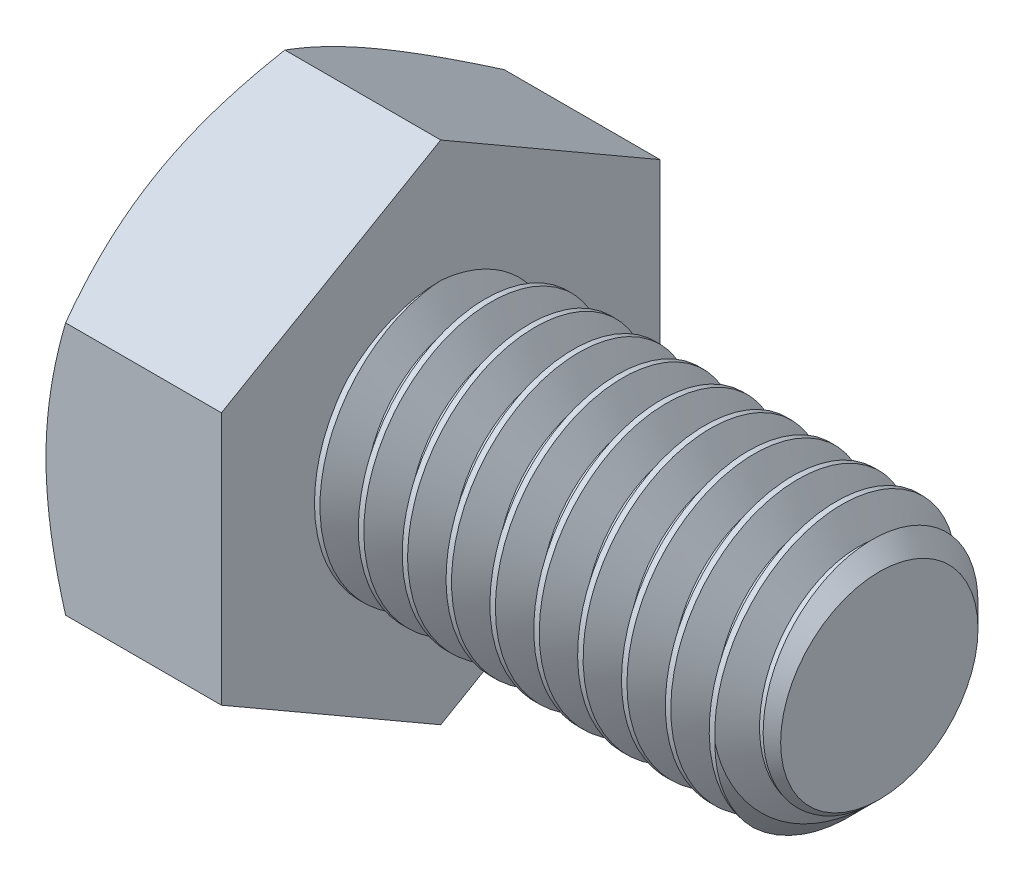
from build123d import *

# Parameters (mm, degrees)
SKETCH2_R           = 3
BOSS_EXTRUDE1_DEPTH = 10
CHAMFER1_SIZE       = 0.75
CUT_SWEEP1_PITCH    = 1
BOSS_EXTRUDE2_DEPTH = 4
SKETCH6_OUTSIDE_W   = 74.854
SKETCH6_OUTSIDE_H   = 76.402
SKETCH6_OUTSIDE_R   = 5
CUT_EXTRUDE1_DEPTH  = 16.947831774
CUT_EXTRUDE1_DRAFT  = -60
SKETCH7_W           = 0.197562976
SKETCH7_H           = 0.197562976
CUT_EXTRUDE2_DEPTH  = 0.25


with BuildPart() as part:
    # Sketch2 → Boss-Extrude1 (new body)
    with BuildSketch(Plane(origin=(7, 0, 0), x_dir=(0, 0, -1), z_dir=(1, 0, 0))):
        Circle(SKETCH2_R)
    extrude(amount=-BOSS_EXTRUDE1_DEPTH)

    # Chamfer1
    chamfer1_edges = [part.edges().sort_by_distance(p)[0] for p in [
        (7, 0, 3),
    ]]
    chamfer(chamfer1_edges, length=CHAMFER1_SIZE)

    # Cut-Sweep1: the profile of Sketch5 profile screwed along a right-hand helix of 11 turns, 8 arcs to a turn; built about Z, then put on its axis
    cut_sweep1_z = Axis((0, 0, 0), (0, 0, 1))
    cut_sweep1_corners = [(3.0003, 0, 0.000173205), (2.350480947, 0, -0.375), (2.350480947, 0, -0.5), (3.0003, 0, -0.875173205)]
    with BuildLine(mode=Mode.PRIVATE) as cut_sweep1_profile:
        Line(cut_sweep1_corners[0], cut_sweep1_corners[1])
        Line(cut_sweep1_corners[1], cut_sweep1_corners[2])
        Line(cut_sweep1_corners[2], cut_sweep1_corners[3])
        Line(cut_sweep1_corners[3], cut_sweep1_corners[0])
    cut_sweep1_cap = Face(cut_sweep1_profile.wire())
    cut_sweep1_turn_angles = [0, 22.5, 45, 67.5, 90, 112.5, 135, 157.5, 180, 202.5, 225, 247.5, 270, 292.5, 315, 337.5, 360]
    cut_sweep1_turn_weights = [1, 0.9238795325112867, 1, 0.9238795325112867, 1, 0.9238795325112867, 1, 0.9238795325112867, 1, 0.9238795325112867, 1, 0.9238795325112867, 1, 0.9238795325112867, 1, 0.9238795325112867, 1]
    cut_sweep1_turn_rails = [Edge.make_bspline([Vector(p[0], p[1], 0).rotate(cut_sweep1_z, cut_sweep1_turn_angles[k]) / cut_sweep1_turn_weights[k] + Vector(0, 0, p[2] + CUT_SWEEP1_PITCH * cut_sweep1_turn_angles[k] / 360) for k in range(17)], [0, 0, 0, 1, 1, 2, 2, 3, 3, 4, 4, 5, 5, 6, 6, 7, 7, 8, 8, 8], 2, cut_sweep1_turn_weights) for p in cut_sweep1_corners]
    cut_sweep1_turn_sides = [Face.make_surface_from_curves(cut_sweep1_turn_rails[p[0]], cut_sweep1_turn_rails[p[1]]) for p in [(0, 1), (1, 2), (2, 3), (3, 0)]]
    cut_sweep1 = Plane(origin=(7, 0, 0), x_dir=(0, 1, 0), z_dir=(-1, 0, 0)) * Solid(Shell([*[p.moved(Location((0, 0, CUT_SWEEP1_PITCH * i))) for i in range(11) for p in cut_sweep1_turn_sides], cut_sweep1_cap, cut_sweep1_cap.rotate(cut_sweep1_z, 3960).moved(Location((0, 0, CUT_SWEEP1_PITCH * 3960 / 360)))]))
    add(cut_sweep1, mode=Mode.SUBTRACT)

    # Sketch3 → Boss-Extrude2 (add)
    with BuildSketch(Plane.ZY.offset(3)):
        Polygon((-5, -2.886751346), (0, -5.773502692), (5, -2.886751346), (5, 2.886751346), (0, 5.773502692), (-5, 2.886751346), align=None)
    extrude(amount=BOSS_EXTRUDE2_DEPTH)


with BuildPart() as cut_extrude1_tool:
    # Sketch6 outside → Cut-Extrude1 (with draft: the straight prism first)
    with BuildSketch(Plane.ZY.offset(7)):
        Rectangle(SKETCH6_OUTSIDE_W, SKETCH6_OUTSIDE_H)
        Circle(SKETCH6_OUTSIDE_R, mode=Mode.SUBTRACT)
    extrude(amount=-CUT_EXTRUDE1_DEPTH)
    # Cut-Extrude1: the draft: its side faces are tilted about the plane it starts from
    cut_extrude1_sides = [cut_extrude1_tool.faces().sort_by_distance(p)[0] for p in [
        (1.473915887, -38.201, 0),
        (1.473915887, 0, 37.427),
        (1.473915887, 38.201, 0),
        (1.473915887, 0, -37.427),
        (1.473915887, 0, -5),
    ]]
    draft(cut_extrude1_sides, Plane.ZY.offset(7), CUT_EXTRUDE1_DRAFT)


with BuildPart() as part_1:
    add(part.part)

    # Cut-Extrude1: cut by cut_extrude1_tool
    add(cut_extrude1_tool.part, mode=Mode.SUBTRACT)

    # Sketch7 → Cut-Extrude2 (cut)
    # profile 1 of 4: a face of its own
    with BuildSketch(Plane.ZY.offset(7)):
        with BuildLine():
            Line((-1.284159342, 2.5), (-1.481722318, 2.5))
            Line((-1.481722318, 2.5), (-1.481722318, 3.700812462))
            add(Edge.make_bspline(
                [(-1.481722318, 3.700812462), (-1.493098012, 3.689842005), (-1.516741144, 3.667041113), (-1.556707362, 3.634772156), (-1.601314769, 3.602066201), (-1.649984109, 3.570615769), (-1.699594268, 3.541008578), (-1.7475361, 3.514381463), (-1.793009194, 3.491848462), (-1.822962567, 3.479527328), (-1.837335675, 3.47361504)],
                knots=[0, 0, 0, 0, 0.893362401, 1.856755847, 2.901947673, 4.020460078, 5.132200827, 6.168787962, 7.121294059, 8, 8, 8, 8], degree=3))
            Line((-1.837335675, 3.47361504), (-1.837335675, 3.655743408))
            add(Edge.make_bspline(
                [(-1.837335675, 3.655743408), (-1.812648378, 3.668457416), (-1.763991177, 3.693515971), (-1.695249075, 3.736795542), (-1.631070927, 3.783712378), (-1.572519137, 3.834256092), (-1.520031188, 3.885920841), (-1.475798832, 3.938052602), (-1.438788011, 3.98874045), (-1.42021898, 4.024089603), (-1.411340508, 4.040991211)],
                knots=[0, 0, 0, 0, 1.141258006, 2.249351951, 3.335817539, 4.406819942, 5.426913362, 6.360259544, 7.215985427, 8, 8, 8, 8], degree=3))
            Line((-1.411340508, 4.040991211), (-1.284159342, 4.040991211))
            Line((-1.284159342, 4.040991211), (-1.284159342, 2.5))
        make_face()
    # profile 2 of 4: a face of its own
    with BuildSketch(Plane.ZY.offset(7)):
        with BuildLine():
            add(Edge.make_bspline(
                [(-0.790251903, 3.260000072), (-0.790052858, 3.282022251), (-0.789663013, 3.325154426), (-0.787244933, 3.388264546), (-0.783023159, 3.448197614), (-0.776721214, 3.50490158), (-0.769258531, 3.558504437), (-0.759556995, 3.608929689), (-0.748641356, 3.656290471), (-0.735544549, 3.700537418), (-0.721155446, 3.742050974), (-0.704830549, 3.780764541), (-0.686462825, 3.816637074), (-0.666954934, 3.85004059), (-0.645279941, 3.880455529), (-0.622746104, 3.908735457), (-0.597715799, 3.933843239), (-0.57122984, 3.956424902), (-0.542898213, 3.976351902), (-0.512870822, 3.993546501), (-0.481263204, 4.008728091), (-0.447472952, 4.020156788), (-0.412201546, 4.029473599), (-0.375177484, 4.036327159), (-0.336359967, 4.040367563), (-0.309833651, 4.04078098), (-0.296344464, 4.040991211)],
                knots=[0, 0, 0, 0, 1.514747001, 2.966751498, 4.343369068, 5.64627492, 6.890416844, 8.064737671, 9.177176366, 10.232018008, 11.237056675, 12.19799043, 13.119080079, 14.007588942, 14.855863561, 15.685992447, 16.491747269, 17.290132607, 18.077525251, 18.870243746, 19.668095604, 20.485086593, 21.319398728, 22.175900658, 23.072407314, 24, 24, 24, 24], degree=3))
            add(Edge.make_bspline(
                [(-0.296344464, 4.040991211), (-0.276554072, 4.040409387), (-0.237675053, 4.039266372), (-0.180911485, 4.029944144), (-0.127415481, 4.013997036), (-0.077221797, 3.992483699), (-0.031188485, 3.965157621), (0.009921203, 3.93193861), (0.045663832, 3.893175459), (0.075649327, 3.848408838), (0.101859643, 3.798873708), (0.125144312, 3.744347738), (0.146192977, 3.68489203), (0.161129567, 3.631670872), (0.171783825, 3.585728479), (0.178836097, 3.547836494), (0.184690897, 3.506950828), (0.189176465, 3.463170395), (0.192856768, 3.416544299), (0.195698897, 3.36704351), (0.197141568, 3.314544309), (0.197419873, 3.278522328), (0.197562976, 3.260000072)],
                knots=[0, 0, 0, 0, 1.134486744, 2.228744715, 3.287356444, 4.328707449, 5.352829806, 6.347195599, 7.349461267, 8.364207941, 9.428085653, 10.559314403, 11.761222316, 13.04268526, 13.726896727, 14.465273606, 15.252205015, 16.094778733, 16.988606776, 17.934225168, 18.937792761, 20, 20, 20, 20], degree=3))
            add(Edge.make_bspline(
                [(0.197562976, 3.260000072), (0.197360203, 3.238081335), (0.196964045, 3.195258767), (0.194610758, 3.132654684), (0.190134593, 3.073173782), (0.184626591, 3.016679807), (0.176294137, 2.963323573), (0.167315467, 2.912878383), (0.156211069, 2.865573301), (0.143254845, 2.821387596), (0.128663193, 2.78008763), (0.11266119, 2.74136128), (0.094937435, 2.705235008), (0.074964401, 2.672061172), (0.053655947, 2.641399446), (0.03085601, 2.613134809), (0.006081205, 2.587674071), (-0.020643434, 2.565160142), (-0.048776137, 2.544879764), (-0.07887653, 2.527515404), (-0.110812868, 2.513129332), (-0.144371773, 2.500829956), (-0.179893749, 2.491817695), (-0.217098671, 2.484918949), (-0.256123623, 2.480856468), (-0.282752541, 2.480450776), (-0.296344464, 2.480243702)],
                knots=[0, 0, 0, 0, 1.508974709, 2.94807912, 4.311757619, 5.615040294, 6.854280449, 8.028314546, 9.141715822, 10.197470207, 11.196696834, 12.155719058, 13.080757287, 13.963948316, 14.818758719, 15.649605906, 16.461113142, 17.260189315, 18.052359509, 18.845763934, 19.647754795, 20.461145776, 21.303032214, 22.167241874, 23.064524267, 24, 24, 24, 24], degree=3))
            add(Edge.make_bspline(
                [(-0.296344464, 2.480243702), (-0.31416505, 2.480752036), (-0.348910289, 2.481743145), (-0.399653148, 2.488477126), (-0.447278028, 2.500329248), (-0.492186617, 2.516224614), (-0.533874131, 2.537485582), (-0.572539611, 2.563353701), (-0.608960011, 2.593227122), (-0.629925808, 2.616796566), (-0.64053621, 2.628724626)],
                knots=[0, 0, 0, 0, 1.10322584, 2.150986741, 3.161425019, 4.136713905, 5.093944212, 6.049774532, 7.013026876, 8, 8, 8, 8], degree=3))
            add(Edge.make_bspline(
                [(-0.64053621, 2.628724626), (-0.652749028, 2.646341795), (-0.677932381, 2.682669151), (-0.707407312, 2.744610663), (-0.733699472, 2.81279957), (-0.754333998, 2.888573732), (-0.770495975, 2.971330072), (-0.782168957, 3.061230974), (-0.788774716, 3.158237599), (-0.789748392, 3.225313505), (-0.790251903, 3.260000072)],
                knots=[0, 0, 0, 0, 0.779365345, 1.607084704, 2.489375761, 3.438383567, 4.461919411, 5.557722155, 6.737039282, 8, 8, 8, 8], degree=3))
        make_face()
        with BuildLine():
            add(Edge.make_bspline(
                [(-0.592688927, 3.260617457), (-0.592492763, 3.230978591), (-0.592117261, 3.174243246), (-0.588194178, 3.093187016), (-0.581440751, 3.020063233), (-0.57251228, 2.954973141), (-0.560723083, 2.897828693), (-0.545920352, 2.84877551), (-0.529234153, 2.807224843), (-0.508585298, 2.77369168), (-0.485977083, 2.746357261), (-0.462635646, 2.722848776), (-0.438011843, 2.702867102), (-0.412266343, 2.686206461), (-0.384999685, 2.673592119), (-0.356510025, 2.664449215), (-0.326791165, 2.659187614), (-0.30655127, 2.658431621), (-0.296344464, 2.658050381)],
                knots=[0, 0, 0, 0, 1.89448813, 3.626469325, 5.185477471, 6.587276848, 7.82441448, 8.910550357, 9.859733512, 10.6775885, 11.416198291, 12.123144072, 12.791880183, 13.439617036, 14.078171869, 14.70637855, 15.347637704, 16, 16, 16, 16], degree=3))
            add(Edge.make_bspline(
                [(-0.296344464, 2.658050381), (-0.286140213, 2.658439952), (-0.265905387, 2.659212463), (-0.236117858, 2.66435804), (-0.207739045, 2.673971614), (-0.180513042, 2.686541403), (-0.154580415, 2.702822298), (-0.130077548, 2.722879447), (-0.106613153, 2.746373973), (-0.084106493, 2.774026105), (-0.063614954, 2.807714303), (-0.046615742, 2.849231123), (-0.032043703, 2.898370213), (-0.020189817, 2.955485547), (-0.011224514, 3.020472726), (-0.00451192, 3.093393697), (-0.000562582, 3.174345633), (-0.000193277, 3.230978457), (0, 3.260617457)],
                knots=[0, 0, 0, 0, 0.652509534, 1.29391342, 1.924290653, 2.562989607, 3.207355802, 3.876242846, 4.583348185, 5.32723334, 6.150888545, 7.094226006, 8.186903555, 9.424320409, 10.81992305, 12.379283064, 14.105084285, 16, 16, 16, 16], degree=3))
            add(Edge.make_bspline(
                [(0, 3.260617457), (-0.000187089, 3.289639765), (-0.000545544, 3.345245408), (-0.00459674, 3.424740087), (-0.010945329, 3.496636517), (-0.01962919, 3.56100098), (-0.03117004, 3.6177636), (-0.045167517, 3.667045216), (-0.061847603, 3.708740728), (-0.081680166, 3.743268967), (-0.103757778, 3.77159149), (-0.126819935, 3.796107098), (-0.151443196, 3.816956825), (-0.178063809, 3.833682782), (-0.205823744, 3.847176663), (-0.235360851, 3.856463495), (-0.266384805, 3.862169035), (-0.287676143, 3.862842166), (-0.298505309, 3.863184533)],
                knots=[0, 0, 0, 0, 1.850066095, 3.544656626, 5.0727657, 6.45041401, 7.682899467, 8.762389858, 9.712573485, 10.538438529, 11.291566246, 11.996865408, 12.681389046, 13.341983376, 13.996294293, 14.643563182, 15.31009126, 16, 16, 16, 16], degree=3))
            add(Edge.make_bspline(
                [(-0.298505309, 3.863184533), (-0.308711474, 3.862916661), (-0.328836725, 3.862388453), (-0.358302727, 3.857346709), (-0.386227312, 3.84891579), (-0.412930404, 3.837495291), (-0.437745374, 3.822125556), (-0.461656324, 3.804180295), (-0.483543356, 3.782315999), (-0.49673229, 3.765970592), (-0.503476896, 3.757611818)],
                knots=[0, 0, 0, 0, 1.021318143, 2.013908504, 2.982026795, 3.937174072, 4.91255697, 5.897578595, 6.924855925, 8, 8, 8, 8], degree=3))
            add(Edge.make_bspline(
                [(-0.503476896, 3.757611818), (-0.510819714, 3.745335366), (-0.5263262, 3.719410087), (-0.543677057, 3.674350882), (-0.559004117, 3.622856788), (-0.57162337, 3.56413553), (-0.580752514, 3.49828784), (-0.58795962, 3.425390186), (-0.591703443, 3.345340795), (-0.592351369, 3.289637751), (-0.592688927, 3.260617457)],
                knots=[0, 0, 0, 0, 0.671104906, 1.417232262, 2.260109084, 3.195198885, 4.23592645, 5.382417421, 6.636286093, 8, 8, 8, 8], degree=3))
        make_face(mode=Mode.SUBTRACT)
    # profile 3 of 4: a face of its own
    with BuildSketch(Plane.ZY.offset(7)):
        with Locations((0.592688927, 2.598781488)):
            Rectangle(SKETCH7_W, SKETCH7_H)
    # profile 4 of 4: a face of its own
    with BuildSketch(Plane.ZY.offset(7)):
        with BuildLine():
            Line((1.007571176, 2.875369654), (1.205134152, 2.895125952))
            add(Edge.make_bspline(
                [(1.205134152, 2.895125952), (1.206920239, 2.885003602), (1.210372897, 2.865436243), (1.218164458, 2.837549402), (1.226067012, 2.811547623), (1.236268145, 2.788010165), (1.246891881, 2.766297683), (1.258922971, 2.746627755), (1.272575767, 2.729395444), (1.291855309, 2.709202247), (1.319210172, 2.688130304), (1.357127719, 2.671061208), (1.398840582, 2.65958445), (1.428236664, 2.658573426), (1.443444492, 2.658050381)],
                knots=[0, 0, 0, 0, 0.994516507, 1.922484754, 2.80151264, 3.623050913, 4.402748861, 5.140924173, 5.850441436, 6.526872911, 7.841975818, 9.161260782, 10.53140107, 12, 12, 12, 12], degree=3))
            add(Edge.make_bspline(
                [(1.443444492, 2.658050381), (1.456751488, 2.658529578), (1.482941721, 2.659472712), (1.521127946, 2.666783962), (1.557442454, 2.678496432), (1.591253108, 2.695301374), (1.622436856, 2.71575252), (1.649674808, 2.7400526), (1.673330676, 2.767155041), (1.692759492, 2.798382253), (1.709342511, 2.83404897), (1.725011258, 2.8746088), (1.739833634, 2.920760517), (1.753006889, 2.971915473), (1.764802895, 3.026206092), (1.773081217, 3.082402208), (1.778174547, 3.13941128), (1.778719417, 3.177774463), (1.778992858, 3.197026874)],
                knots=[0, 0, 0, 0, 0.897794352, 1.766998465, 2.614902619, 3.466100941, 4.308008728, 5.124841802, 5.922729683, 6.728261092, 7.598214292, 8.574707161, 9.662086263, 10.868425066, 12.139522319, 13.41071447, 14.70057738, 16, 16, 16, 16], degree=3))
            add(Edge.make_bspline(
                [(1.778992858, 3.197026874), (1.778899344, 3.202274865), (1.778675616, 3.214830375), (1.778290769, 3.227382036), (1.778066782, 3.234687316)],
                knots=[0, 0, 0, 0, 0.835966126, 2, 2, 2, 2], degree=3))
            add(Edge.make_bspline(
                [(1.778066782, 3.234687316), (1.768542584, 3.22022413), (1.749509536, 3.191321063), (1.714445959, 3.152529649), (1.674332612, 3.118121138), (1.629778386, 3.088362715), (1.58188343, 3.063940569), (1.531480967, 3.046194448), (1.479005485, 3.035236452), (1.443291513, 3.034030076), (1.425231655, 3.033420035)],
                knots=[0, 0, 0, 0, 0.978840568, 1.956103883, 2.947027447, 3.962820877, 4.980997961, 5.980964245, 6.979013046, 8, 8, 8, 8], degree=3))
            add(Edge.make_bspline(
                [(1.425231655, 3.033420035), (1.410181713, 3.033809962), (1.380555612, 3.034577542), (1.337158587, 3.041399547), (1.295419155, 3.051630137), (1.255732843, 3.067119745), (1.21748219, 3.086276405), (1.181068826, 3.109789736), (1.146436643, 3.137627733), (1.114033143, 3.169443767), (1.084462099, 3.2049069), (1.05838385, 3.243153184), (1.036728508, 3.28436963), (1.018710514, 3.328041798), (1.004807734, 3.374591649), (0.995147123, 3.423910112), (0.988649898, 3.475808926), (0.98809691, 3.511357846), (0.987814879, 3.529488319)],
                knots=[0, 0, 0, 0, 0.975490236, 1.920271282, 2.842894855, 3.757591483, 4.67685385, 5.613562631, 6.563069669, 7.554119451, 8.55387214, 9.553424333, 10.550567425, 11.568071726, 12.613215376, 13.695622473, 14.824733476, 16, 16, 16, 16], degree=3))
            add(Edge.make_bspline(
                [(0.987814879, 3.529488319), (0.988237289, 3.548232953), (0.989063596, 3.584900708), (0.995305351, 3.63851352), (1.005631769, 3.689304987), (1.020691426, 3.737178163), (1.039315186, 3.782440645), (1.062799025, 3.824766099), (1.090238676, 3.864335583), (1.12179809, 3.900767612), (1.1564816, 3.933457226), (1.193305446, 3.962633275), (1.232749472, 3.986615849), (1.274057373, 4.006611333), (1.317541757, 4.022064144), (1.363128302, 4.033233279), (1.410943155, 4.039786979), (1.443527149, 4.040584988), (1.460113868, 4.040991211)],
                knots=[0, 0, 0, 0, 1.151671969, 2.252870106, 3.311924673, 4.331900944, 5.332425074, 6.314476151, 7.300265758, 8.286521684, 9.270545387, 10.225535917, 11.167946231, 12.101233205, 13.04124339, 13.998220545, 14.981004193, 16, 16, 16, 16], degree=3))
            add(Edge.make_bspline(
                [(1.460113868, 4.040991211), (1.472160605, 4.04074757), (1.49610549, 4.040263292), (1.53174045, 4.036565994), (1.56653158, 4.029901008), (1.600705712, 4.021487923), (1.633686425, 4.009809927), (1.666109474, 3.996305519), (1.697583789, 3.979788608), (1.728292766, 3.961006809), (1.758043531, 3.940290273), (1.78541595, 3.916489215), (1.811504082, 3.891230711), (1.835777069, 3.863722031), (1.857467159, 3.833538628), (1.878046883, 3.801747632), (1.896524197, 3.767655353), (1.913374225, 3.731215619), (1.928371403, 3.691678329), (1.940882807, 3.648169752), (1.951607872, 3.600539191), (1.960537546, 3.548723511), (1.967159045, 3.492759655), (1.972032081, 3.432730793), (1.975222249, 3.368591267), (1.975491252, 3.324417814), (1.975629758, 3.301673513)],
                knots=[0, 0, 0, 0, 0.850689348, 1.69088598, 2.526071361, 3.350886897, 4.173587108, 4.994166539, 5.82944675, 6.680632524, 7.535501428, 8.385942454, 9.238956306, 10.098905971, 10.972410977, 11.861345628, 12.77184846, 13.708225841, 14.694799433, 15.754852217, 16.902446579, 18.141290626, 19.466225842, 20.880733292, 22.39393263, 24, 24, 24, 24], degree=3))
            add(Edge.make_bspline(
                [(1.975629758, 3.301673513), (1.975490325, 3.277900399), (1.975218576, 3.231567557), (1.972003363, 3.163933366), (1.967132776, 3.099998865), (1.960506598, 3.039722069), (1.951514674, 2.983194972), (1.940827057, 2.930427456), (1.928222834, 2.881322105), (1.913411036, 2.835874606), (1.896572884, 2.793562676), (1.878123243, 2.753865304), (1.857460667, 2.716841197), (1.834817321, 2.682419349), (1.81048396, 2.650539597), (1.784080657, 2.621287341), (1.755598839, 2.594751007), (1.725401557, 2.570631953), (1.69353413, 2.54937701), (1.660430384, 2.530622167), (1.625716723, 2.515258667), (1.589750014, 2.502655004), (1.552594169, 2.492248635), (1.513946549, 2.485236805), (1.473985704, 2.481265544), (1.446951668, 2.480587277), (1.433257651, 2.480243702)],
                knots=[0, 0, 0, 0, 1.538356107, 2.998194159, 4.380716326, 5.687456969, 6.921258146, 8.08355215, 9.170518603, 10.200253214, 11.174652363, 12.115998813, 13.031191965, 13.915860606, 14.780247615, 15.624154577, 16.462764255, 17.29681422, 18.1223677, 18.939254916, 19.756006416, 20.575278551, 21.404021733, 22.250368457, 23.113728878, 24, 24, 24, 24], degree=3))
            add(Edge.make_bspline(
                [(1.433257651, 2.480243702), (1.418732748, 2.480494839), (1.390314716, 2.480986189), (1.348827314, 2.486152771), (1.309305056, 2.494007659), (1.271862965, 2.505603334), (1.236220636, 2.519877298), (1.202986414, 2.538118612), (1.171569683, 2.559163632), (1.142358031, 2.583436747), (1.115693486, 2.610848821), (1.091567168, 2.640724272), (1.070415495, 2.673450039), (1.052349162, 2.70883318), (1.036346581, 2.746576015), (1.023940229, 2.787184652), (1.013861262, 2.83028456), (1.00970173, 2.860098607), (1.007571176, 2.875369654)],
                knots=[0, 0, 0, 0, 1.08199657, 2.11693069, 3.111083497, 4.081436044, 5.034173265, 5.967546613, 6.901297947, 7.84883568, 8.792454994, 9.747011506, 10.706361727, 11.690764787, 12.70483191, 13.757514363, 14.851376857, 16, 16, 16, 16], degree=3))
        make_face()
        with BuildLine():
            add(Edge.make_bspline(
                [(1.778066782, 3.533810009), (1.777844584, 3.546167498), (1.777412091, 3.570220558), (1.773622923, 3.605313673), (1.767526176, 3.638360963), (1.758968941, 3.669552455), (1.747347963, 3.698557507), (1.733885852, 3.72605331), (1.717423045, 3.751277762), (1.698847657, 3.774570528), (1.678386493, 3.79540537), (1.656104474, 3.813571489), (1.632419371, 3.829143971), (1.606762975, 3.84138813), (1.579978695, 3.851477273), (1.551423134, 3.858071145), (1.521489215, 3.862690284), (1.500880058, 3.863017562), (1.490365698, 3.863184533)],
                knots=[0, 0, 0, 0, 1.20361398, 2.342757417, 3.433960756, 4.474970456, 5.487648377, 6.473933575, 7.452701285, 8.415527761, 9.372491588, 10.291530068, 11.211879743, 12.12647906, 13.055739058, 13.994253148, 14.97671008, 16, 16, 16, 16], degree=3))
            add(Edge.make_bspline(
                [(1.490365698, 3.863184533), (1.479550713, 3.862856809), (1.458245164, 3.862211193), (1.427017644, 3.858053397), (1.397402188, 3.850092498), (1.36919886, 3.839532546), (1.342094419, 3.826470071), (1.317074221, 3.809354236), (1.29309033, 3.789957753), (1.271104705, 3.76745525), (1.251021561, 3.742783687), (1.233326098, 3.716174633), (1.218424276, 3.687615052), (1.206512128, 3.657224018), (1.19677715, 3.625266419), (1.190089912, 3.591456506), (1.18597516, 3.555830273), (1.185579924, 3.531454958), (1.185377855, 3.518992786)],
                knots=[0, 0, 0, 0, 1.007165334, 1.984118292, 2.925321257, 3.856078893, 4.785899085, 5.718627206, 6.671847665, 7.654235469, 8.641842333, 9.630378272, 10.624608936, 11.635186472, 12.665777387, 13.731187195, 14.840042241, 16, 16, 16, 16], degree=3))
            add(Edge.make_bspline(
                [(1.185377855, 3.518992786), (1.185564481, 3.50786364), (1.185930382, 3.48604371), (1.190287864, 3.454199511), (1.196100099, 3.423807131), (1.2053659, 3.395176801), (1.216528497, 3.367892863), (1.231036441, 3.342581934), (1.247371005, 3.318487167), (1.266510109, 3.29641574), (1.287668429, 3.276393087), (1.31077761, 3.258941189), (1.335545758, 3.244002062), (1.36220298, 3.231978182), (1.390589415, 3.222718025), (1.420641701, 3.215900682), (1.452490468, 3.211840104), (1.474301842, 3.211433897), (1.485426624, 3.211226713)],
                knots=[0, 0, 0, 0, 1.102204012, 2.160993585, 3.181057555, 4.164839289, 5.138418409, 6.097303793, 7.050641095, 8.019669129, 8.986440483, 9.932879371, 10.884360123, 11.847412593, 12.824617322, 13.839006415, 14.897795988, 16, 16, 16, 16], degree=3))
            add(Edge.make_bspline(
                [(1.485426624, 3.211226713), (1.495831895, 3.211435921), (1.516311795, 3.211847691), (1.546312698, 3.215925579), (1.574819195, 3.222755565), (1.601959278, 3.232041219), (1.627688956, 3.244060942), (1.651835213, 3.259118787), (1.674864814, 3.276371256), (1.696102673, 3.296529924), (1.715513299, 3.318849511), (1.732299881, 3.343550515), (1.746634721, 3.37018436), (1.7579177, 3.399066744), (1.76695483, 3.429842075), (1.773317571, 3.462705196), (1.777484418, 3.497585953), (1.777869725, 3.521552704), (1.778066782, 3.533810009)],
                knots=[0, 0, 0, 0, 1.017004716, 2.00169281, 2.953445817, 3.879374072, 4.80207141, 5.723561102, 6.657273834, 7.611045633, 8.581233951, 9.544037932, 10.525327521, 11.53237926, 12.57032081, 13.657564536, 14.802009319, 16, 16, 16, 16], degree=3))
        make_face(mode=Mode.SUBTRACT)
    extrude(amount=-CUT_EXTRUDE2_DEPTH, mode=Mode.SUBTRACT)


solid = part_1.part
